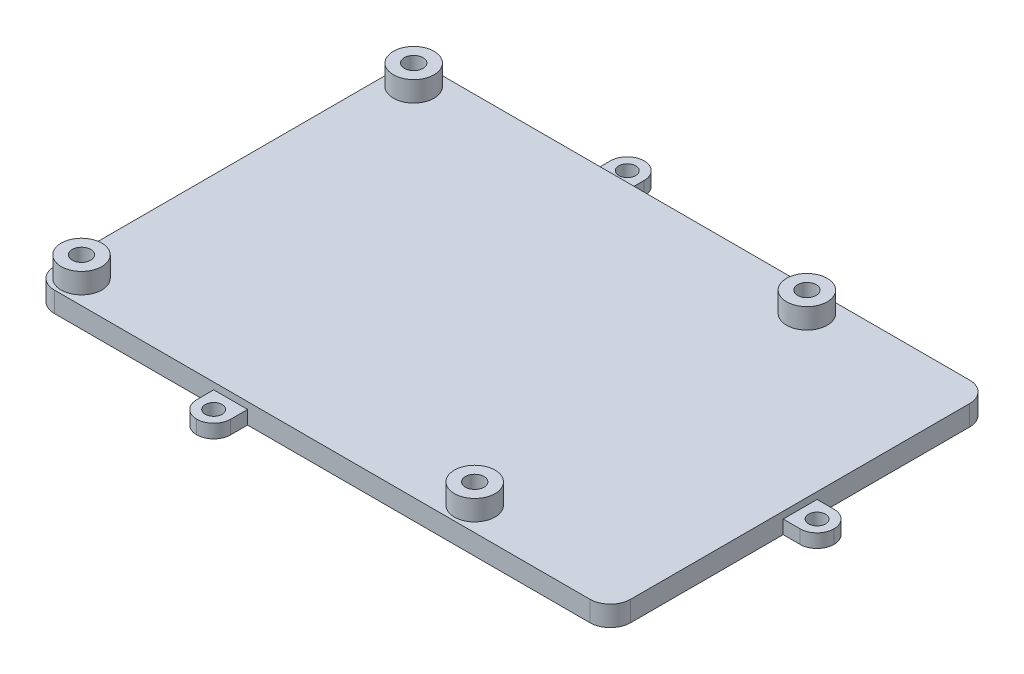
from build123d import *

# Parameters (mm, degrees)
SKETCH1_W           = 85
SKETCH1_H           = 56
SKETCH1_R           = 1.375
BOSS_EXTRUDE1_DEPTH = 3
FILLET1_R           = 3
SKETCH3_R           = 3
SKETCH3_R_2         = 1.375
BOSS_EXTRUDE3_DEPTH = 3
SKETCH5_W           = 5
SKETCH5_H           = 5
SKETCH5_R           = 1.25
BOSS_EXTRUDE4_DEPTH = 2
FILLET2_R           = 2.5
SKETCH6_W           = 5
SKETCH6_H           = 5
SKETCH6_R           = 1.25
BOSS_EXTRUDE5_DEPTH = 2
FILLET3_R           = 2.5
SKETCH8_W           = 5
SKETCH8_H           = 5
SKETCH8_R           = 1.25
BOSS_EXTRUDE7_DEPTH = 2
FILLET5_R           = 2.5


with BuildPart() as part:
    # Sketch1 → Boss-Extrude1 (new body)
    with BuildSketch(Plane(origin=(0, 0, 0), x_dir=(1, 0, 0), z_dir=(0, 1, 0))):
        with Locations((42.5, 28)):
            Rectangle(SKETCH1_W, SKETCH1_H)
        with Locations(Location((3.5, 52.5, 0), (0, 0, 270))):
            Circle(SKETCH1_R, mode=Mode.SUBTRACT)
        with Locations(Location((61.5, 52.5, 0), (0, 0, 270))):
            Circle(SKETCH1_R, mode=Mode.SUBTRACT)
        with Locations(Location((3.5, 3.5, 0), (0, 0, 270))):
            Circle(SKETCH1_R, mode=Mode.SUBTRACT)
        with Locations(Location((61.5, 3.5, 0), (0, 0, 270))):
            Circle(SKETCH1_R, mode=Mode.SUBTRACT)
    extrude(amount=BOSS_EXTRUDE1_DEPTH)

    # Fillet1
    fillet1_edges = [part.edges().sort_by_distance(p)[0] for p in [
        (0, 1.5, -56),
        (85, 1.5, -56),
        (85, 1.5, 0),
        (0, 1.5, 0),
    ]]
    fillet(fillet1_edges, radius=FILLET1_R)

    # Sketch3 → Boss-Extrude3 (add)
    # profile 1 of 4: a face of its own
    with BuildSketch(Plane(origin=(0, 3, 0), x_dir=(1, 0, 0), z_dir=(0, 1, 0))):
        with Locations(Location((3.5, 52.5, 0), (0, 0, 270))):
            Circle(SKETCH3_R)
        with Locations(Location((3.5, 52.5, 0), (0, 0, 270))):
            Circle(SKETCH3_R_2, mode=Mode.SUBTRACT)
    # profile 2 of 4: a face of its own
    with BuildSketch(Plane(origin=(0, 3, 0), x_dir=(1, 0, 0), z_dir=(0, 1, 0))):
        with Locations(Location((61.5, 52.5, 0), (0, 0, 270))):
            Circle(SKETCH3_R)
        with Locations(Location((61.5, 52.5, 0), (0, 0, 270))):
            Circle(SKETCH3_R_2, mode=Mode.SUBTRACT)
    # profile 3 of 4: a face of its own
    with BuildSketch(Plane(origin=(0, 3, 0), x_dir=(1, 0, 0), z_dir=(0, 1, 0))):
        with Locations(Location((3.5, 3.5, 0), (0, 0, 270))):
            Circle(SKETCH3_R)
        with Locations(Location((3.5, 3.5, 0), (0, 0, 270))):
            Circle(SKETCH3_R_2, mode=Mode.SUBTRACT)
    # profile 4 of 4: a face of its own
    with BuildSketch(Plane(origin=(0, 3, 0), x_dir=(1, 0, 0), z_dir=(0, 1, 0))):
        with Locations(Location((61.5, 3.5, 0), (0, 0, 270))):
            Circle(SKETCH3_R)
        with Locations(Location((61.5, 3.5, 0), (0, 0, 270))):
            Circle(SKETCH3_R_2, mode=Mode.SUBTRACT)
    extrude(amount=BOSS_EXTRUDE3_DEPTH)

    # Sketch5 → Boss-Extrude4 (add)
    with BuildSketch(Plane.XZ):
        with Locations((29, 2.5)):
            Rectangle(SKETCH5_W, SKETCH5_H)
        with Locations(Location((29, 2.5, 0), (0, 0, 270))):
            Circle(SKETCH5_R, mode=Mode.SUBTRACT)
    extrude(amount=-BOSS_EXTRUDE4_DEPTH)

    # Fillet2
    fillet2_edges = [part.edges().sort_by_distance(p)[0] for p in [
        (26.5, 1, 5),
        (31.5, 1, 5),
    ]]
    fillet(fillet2_edges, radius=FILLET2_R - 0.0001)  # a hair under: the kernel refuses the full size

    # Sketch6 → Boss-Extrude5 (add)
    with BuildSketch(Plane.XZ):
        with Locations((29, -58.5)):
            Rectangle(SKETCH6_W, SKETCH6_H)
        with Locations(Location((29, -58.5, 0), (0, 0, 270))):
            Circle(SKETCH6_R, mode=Mode.SUBTRACT)
    extrude(amount=-BOSS_EXTRUDE5_DEPTH)

    # Fillet3
    fillet3_edges = [part.edges().sort_by_distance(p)[0] for p in [
        (31.5, 1, -61),
        (26.5, 1, -61),
    ]]
    fillet(fillet3_edges, radius=FILLET3_R - 0.0001)  # a hair under: the kernel refuses the full size

    # Sketch8 → Boss-Extrude7 (add)
    with BuildSketch(Plane.XZ):
        with Locations((87.5, -28)):
            Rectangle(SKETCH8_W, SKETCH8_H)
        with Locations(Location((87.5, -28, 0), (0, 0, 270))):
            Circle(SKETCH8_R, mode=Mode.SUBTRACT)
    extrude(amount=-BOSS_EXTRUDE7_DEPTH)

    # Fillet5
    fillet5_edges = [part.edges().sort_by_distance(p)[0] for p in [
        (90, 1, -30.5),
        (90, 1, -25.5),
    ]]
    fillet(fillet5_edges, radius=FILLET5_R - 0.0001)  # a hair under: the kernel refuses the full size


solid = part.part
